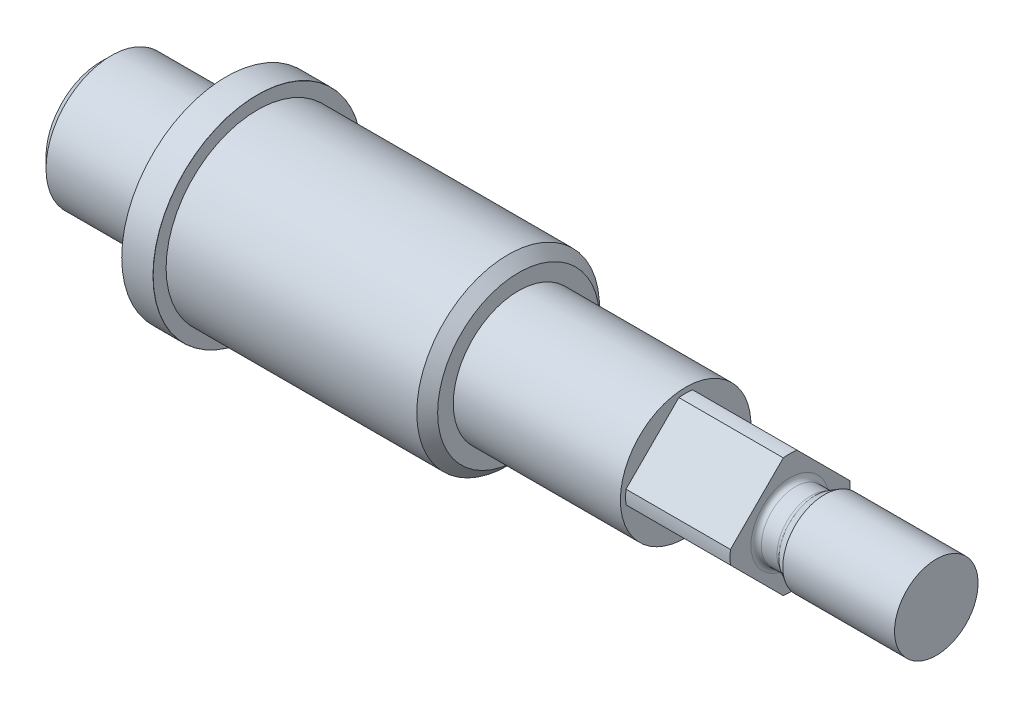
from build123d import *

# Parameters (mm, degrees)
SKETCH_2_W          = 24
SKETCH_2_H          = 12.5
SKETCH_2_W_2        = 32
FILLET_2_R          = 0.02
CUT_EXTRUDE_1_DEPTH = 20
CUT_EXTRUDE_2_DEPTH = 20
EXTRUDE_2_DEPTH     = 12.5
CHAMFER_3_SIZE      = 2


with BuildPart() as part:
    # 草图2 → 旋转1 (revolve)
    with BuildSketch(Plane(origin=(0, 0, 0), x_dir=(1, 0, 0), z_dir=(0, 1, 0)), mode=Mode.PRIVATE) as revolve_1_sk:
        with Locations((-68, 6.25)):
            Rectangle(SKETCH_2_W, SKETCH_2_H)
        Polygon((-56, 0), (-50, 0), (-50, 17.5), (-50, 20), (-56, 20), (-56, 12.5), align=None)
        Polygon((-50, 0), (0, 0), (0, 12.5), (0, 17.5), (-50, 17.5), align=None)
        with Locations((16, 6.25)):
            Rectangle(SKETCH_2_W_2, SKETCH_2_H)
        Polygon((52, 0), (52, 7.5), (52, 11.5), (32, 11.5), (32, 0), align=None)
        with BuildLine():
            ThreePointArc((56, 6.5), (56.707106781, 6.792893219), (57, 7.5))
            Line((57, 7.5), (57, 0))
            Line((57, 0), (52, 0))
            Line((52, 0), (52, 7.5))
            ThreePointArc((52, 7.5), (52.292893219, 6.792893219), (53, 6.5))
            Line((53, 6.5), (56, 6.5))
        make_face()
        Polygon((57, 8), (57, 7.5), (57, 0), (80, 0), (80, 8), align=None)
    revolve(revolve_1_sk.sketch.rotate(Axis((-92.921580587, 0, 0), (1, 0, 0)), 180), axis=Axis((-92.921580587, 0, 0), (1, 0, 0)))

    # 倒角2: read off the stored shape, not the designer's step
    # 倒角2 outline → 倒角2 (revolve, cut)
    with BuildSketch(Plane.YX):
        Polygon((7, 56.866025404), (7.5, 56.866025404), (7.5, 57), (8, 57), (8, 58.598076211), align=None)
        Polygon((17.5, 0), (15.5, 0), (17.5, -2), align=None)
    revolve(axis=Axis((0, 0, 0), (1, 0, 0)), mode=Mode.SUBTRACT)

    # 圆角2
    fillet_2_edges = [part.edges().sort_by_distance(p)[0] for p in [
        (-50, 0, -20),
    ]]
    fillet(fillet_2_edges, radius=FILLET_2_R)

    # 草图3 → 切除-拉伸1 (cut)
    with BuildSketch(Plane(origin=(52, 0, 0), x_dir=(0, 0, -1), z_dir=(1, 0, 0))):
        Polygon((13.451018428, -3.326790062), (11.426075214, -1.301846848), (1.301846848, -11.426075214), (3.326790062, -13.451018428), align=None)
        Polygon((1.301846848, 11.426075214), (11.426075214, 1.301846848), (13.451018428, 3.326790062), (3.326790062, 13.451018428), align=None)
        Polygon((-13.451018428, 3.326790062), (-11.426075214, 1.301846848), (-1.301846848, 11.426075214), (-3.326790062, 13.451018428), align=None)
        Polygon((-1.301846848, -11.426075214), (-3.326790062, -13.451018428), (-13.451018428, -3.326790062), (-11.426075214, -1.301846848), align=None)
    extrude(amount=-CUT_EXTRUDE_1_DEPTH, mode=Mode.SUBTRACT)

    # 草图5 → 切除-拉伸2 (cut)
    with BuildSketch(Plane.XY):
        with BuildLine():
            Line((-33.02, 5), (-17.02, 5))
            ThreePointArc((-17.02, 5), (-12.02, 0), (-17.02, -5))
            Line((-17.02, -5), (-33.02, -5))
            ThreePointArc((-33.02, -5), (-38.02, 0), (-33.02, 5))
        make_face()
    extrude(amount=-CUT_EXTRUDE_2_DEPTH, mode=Mode.SUBTRACT)

    # 草图4 → 凸台-拉伸2 (add)
    with BuildSketch(Plane.XY):
        with BuildLine():
            Line((-33.02, 5), (-17.02, 5))
            ThreePointArc((-17.02, 5), (-12.02, 0), (-17.02, -5))
            Line((-17.02, -5), (-33.02, -5))
            ThreePointArc((-33.02, -5), (-38.02, 0), (-33.02, 5))
        make_face()
    extrude(amount=-EXTRUDE_2_DEPTH)

    # 倒角3
    chamfer_3_edges = [part.edges().sort_by_distance(p)[0] for p in [
        (-80, 0, -12.5),
    ]]
    chamfer(chamfer_3_edges, length=CHAMFER_3_SIZE)


solid = part.part
